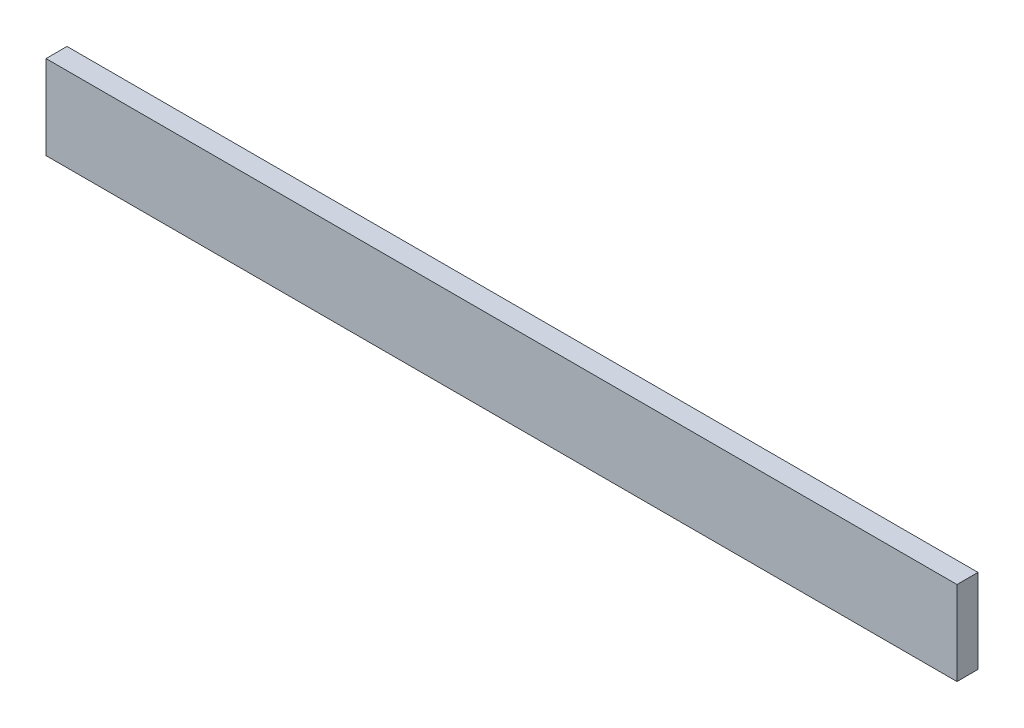
from build123d import *

# Parameters (mm, degrees)
SKETCH2_W           = 550.492212136
SKETCH2_H           = 12.7
BOSS_EXTRUDE1_DEPTH = 50.8
SCALE2_SCALE        = 0.06
ROTATE_ANGLE        = 90
SCALE5_SCALE        = 0.25
SCALE6_SCALE        = 0.25


with BuildPart() as part:
    # Sketch2 → Boss-Extrude1 (new body)
    with BuildSketch(Plane.XY):
        with Locations((227.376875299, 14.898076923)):
            Rectangle(SKETCH2_W, SKETCH2_H)
    extrude(amount=BOSS_EXTRUDE1_DEPTH)


with BuildPart() as part_1:
    # Scale2: scaled about (227.376875299, 14.898076923, 25.4)
    add(part.part.scale(SCALE2_SCALE).moved(Location((213.734262781, 14.004192308, 23.876))))


with BuildPart() as part_2:
    # rotate: moved
    add(part_1.part.rotate(Axis((0, 33.666927966, 26.550068274), (1, 0, 0)), ROTATE_ANGLE))


with BuildPart() as part_3:
    # Scale5: scaled about (227.376875299, 34.81699624, 7.781217231)
    add(part_2.part.scale(SCALE5_SCALE).moved(Location((170.532656474, 26.11274718, 5.835912923))))


with BuildPart() as part_4:
    # Move Body 4 x: moved
    add(part_3.part.moved(Location((-101.6, 0, 0))))


with BuildPart() as part_5:
    # Move Body 2 y: moved
    add(part_4.part.moved(Location((0, -55.88, 0))))


with BuildPart() as part_6:
    # Scale6: scaled about (125.776875299, -21.06300376, 7.781217231)
    add(part_5.part.scale(SCALE6_SCALE).moved(Location((94.332656474, -15.79725282, 5.835912923))))


with BuildPart() as part_7:
    # Move Body 2.1z: moved
    add(part_6.part.moved(Location((0, 0, -30.48))))


solid = part_7.part
